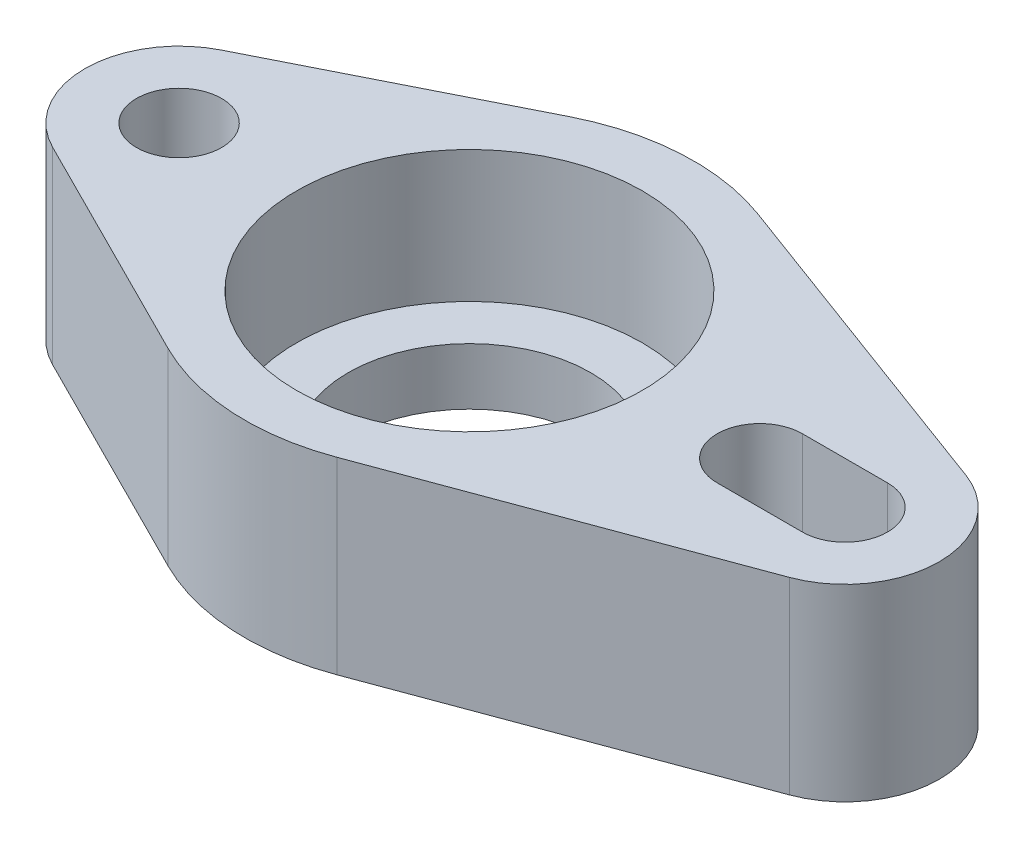
from build123d import *

# Parameters (mm, degrees)
SKETCH1_R     = 6.7
SKETCH1_R_2   = 1.65
BODY_DEPTH    = 7.3
SKETCH1_4_R   = 6.7
SKETCH1_4_R_2 = 4.7
FLOOR_2_DEPTH = 2.2


with BuildPart() as part:
    # Sketch1 → Body (new body)
    with BuildSketch(Plane(origin=(0, 0, 0), x_dir=(1, 0, 0), z_dir=(0, 1, 0))):
        with BuildLine():
            ThreePointArc((15.816838488, -3.423100969), (18.2, 0), (15.816838488, 3.423100969))
            Line((15.816838488, 3.423100969), (3.019587629, 8.159172173))
            ThreePointArc((3.019587629, 8.159172173), (-0.482892281, 8.686588228), (-3.905333333, 7.774211957))
            Line((-3.905333333, 7.774211957), (-12.888444444, 3.261594672))
            ThreePointArc((-12.888444444, 3.261594672), (-14.9, 0), (-12.888444444, -3.261594672))
            Line((-12.888444444, -3.261594672), (-3.905333333, -7.774211957))
            ThreePointArc((-3.905333333, -7.774211957), (-0.482892281, -8.686588228), (3.019587629, -8.159172173))
            Line((3.019587629, -8.159172173), (15.816838488, -3.423100969))
        make_face()
        with BuildLine():
            Line((11.25, 1.65), (14.55, 1.65))
            ThreePointArc((14.55, 1.65), (16.2, 0), (14.55, -1.65))
            Line((14.55, -1.65), (11.25, -1.65))
            ThreePointArc((11.25, -1.65), (9.6, 0), (11.25, 1.65))
        make_face(mode=Mode.SUBTRACT)
        Circle(SKETCH1_R, mode=Mode.SUBTRACT)
        with Locations((-11.25, 0)):
            Circle(SKETCH1_R_2, mode=Mode.SUBTRACT)
    extrude(amount=BODY_DEPTH)

    # Sketch1<4> → Floor 2 (add)
    with BuildSketch(Plane(origin=(0, 0, 0), x_dir=(1, 0, 0), z_dir=(0, 1, 0))):
        Circle(SKETCH1_4_R)
        Circle(SKETCH1_4_R_2, mode=Mode.SUBTRACT)
    extrude(amount=FLOOR_2_DEPTH)


solid = part.part
